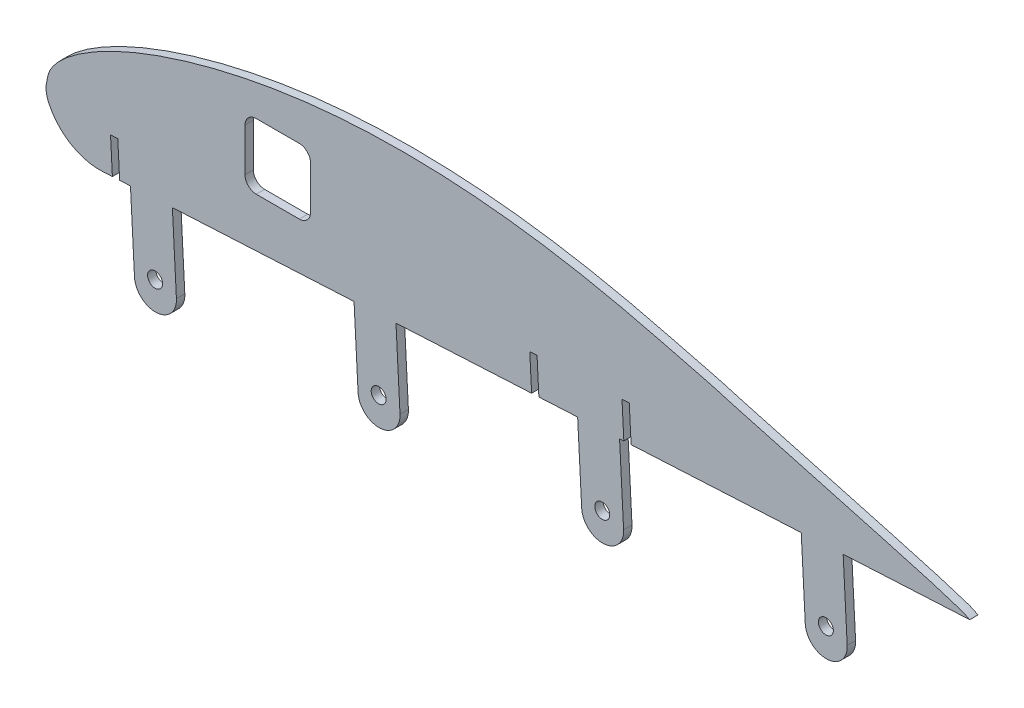
from build123d import *

# Parameters (mm, degrees)
BOSS_EXTRUDE1_DEPTH     = 1.905
BOSS_EXTRUDE2_START     = -1.905
BOSS_EXTRUDE2_DEPTH     = 3.81
TAP_DRILL_FOR_M8_TAP1_D = 6.8
FILLET1_R               = 5.08
CUT_EXTRUDE1_DEPTH      = 423.240896091
CUT_EXTRUDE1_DEPTH_BACK = 423.240896091
FILLET3_RADIUS          = 9.525
FILLET3_LENGTH          = 3.81
FILLET4_RADIUS          = 9.525
FILLET4_LENGTH          = 3.81
FILLET5_RADIUS          = 9.525
FILLET5_LENGTH          = 3.81
FILLET6_RADIUS          = 9.525
FILLET6_LENGTH          = 3.81


# Read off the part's stored shape, not the designer's step: Boss-Extrude2
with BuildPart() as part:
    # Sketch1 → Boss-Extrude1 (new, symmetric)
    with BuildSketch(Plane.XY):
        with BuildLine():
            Line((88.909580783, 41.26391721), (118.627580783, 41.26391721))
            Line((118.627580783, 41.26391721), (118.627580783, 11.54591721))
            Line((118.627580783, 11.54591721), (104.657580783, 11.54591721))
            Line((104.657580783, 11.54591721), (104.657580783, -6.092999308))
            add(Edge.make_bspline(
                [(104.657580783, -6.092999308), (105.78576696, -6.059407355), (110.631815253, -5.913506799), (119.301873398, -5.639779221), (130.760417354, -5.247131629), (142.497040297, -4.804534274), (154.470843852, -4.303823254), (166.639786874, -3.721010638), (178.960468691, -3.016797235), (191.389100737, -2.180004159), (203.882560612, -1.218144366), (216.39628583, -0.134616133), (228.885986304, 1.060875443), (241.307012185, 2.343253014), (253.616279039, 3.664244089), (265.772095128, 4.965053183), (277.731490713, 6.209836508), (289.45199663, 7.374456804), (300.891969345, 8.438297263), (312.011551274, 9.378204355), (322.771419978, 10.182138596), (333.133998236, 10.833574931), (343.062487119, 11.328143195), (352.522037602, 11.650436807), (361.47904928, 11.831540776), (369.902441551, 11.810346197), (377.762625202, 11.656292062), (385.030592513, 11.344437654), (391.68484956, 10.895614899), (397.689387538, 10.328444191), (403.063035719, 9.638969084), (407.663858949, 8.932969554), (411.84953295, 7.985992463), (414.53368223, 7.52009233), (419.143107129, 5.466978357), (414.520586066, 7.829160816), (411.856340794, 8.603478482), (407.655866836, 10.032984433), (403.060664813, 11.413668567), (397.685628885, 12.995705784), (391.682523818, 14.702815518), (385.029118067, 16.561547034), (377.76192652, 18.564224708), (369.902953821, 20.715322997), (361.480188002, 23.009061308), (352.523844819, 25.446080399), (343.06573052, 28.021990963), (333.136012333, 30.718866033), (322.7818834, 33.570585543), (311.975311356, 36.398897394), (300.975484828, 39.84355007), (289.42464591, 42.471486304), (277.760382476, 45.638812888), (265.799607232, 48.558228126), (253.647270041, 51.317410307), (241.333764909, 53.799191005), (228.908808416, 55.982875957), (216.414443808, 57.828987679), (203.896579889, 59.324649469), (191.398887145, 60.45608609), (178.965067687, 61.204134062), (166.639581281, 61.567998585), (154.466261788, 61.564684681), (142.487428182, 61.192168146), (130.745466135, 60.461851913), (119.27965342, 59.390109524), (108.135195394, 57.951193311), (97.349793586, 56.195302776), (86.959680907, 54.167962822), (77.001482933, 51.901273201), (67.510182352, 49.425050582), (58.519352194, 46.765961709), (50.060387838, 43.951821062), (42.162499305, 41.011003286), (34.853856572, 37.969908862), (28.15980047, 34.856885781), (22.102555486, 31.702210335), (16.703758276, 28.533121102), (11.978464499, 25.379509483), (7.942830392, 22.262794683), (4.5824322, 19.18797639), (1.957778069, 16.087560883), (-0.207226816, 12.684684668), (-0.907805064, 9.228884918), (-1.560514008, 5.882802979), (-1.147165708, 2.816033578), (-0.009188676, -0.274836968), (1.841756771, -3.001235322), (4.508620223, -5.171701763), (7.983340931, -6.442446365), (12.066016603, -7.059329176), (16.790523111, -7.394736703), (22.181697881, -7.563354981), (28.230842797, -7.674266105), (34.916798872, -7.484533075), (42.21994635, -7.600539498), (50.111658487, -7.421501694), (58.565799156, -7.276468805), (67.552092336, -7.074739405), (77.0391238, -6.84918955), (86.993460829, -6.592701098), (95.404954455, -6.362178203), (100.494330717, -6.215531943), (102.117580783, -6.167999853)],
                knots=[0.639208193, 0.639208193, 0.639208193, 0.639208193, 0.643094929, 0.655903573, 0.669079202, 0.6825766, 0.696348373, 0.710348009, 0.724529116, 0.738844327, 0.753243365, 0.767678182, 0.782097111, 0.79644888, 0.810678263, 0.824728613, 0.838547559, 0.852083943, 0.865287848, 0.878111787, 0.890511304, 0.902443005, 0.913865891, 0.924742046, 0.935035831, 0.944714495, 0.953747112, 0.962105881, 0.969765452, 0.97670305, 0.982898839, 0.988333206, 0.992993712, 0.996866343, 1, 1.003263265, 1.007250558, 1.012051787, 1.017662333, 1.024068314, 1.031249696, 1.03918465, 1.047847638, 1.057210696, 1.067242333, 1.07790876, 1.089173985, 1.100998599, 1.113341295, 1.126157183, 1.139462308, 1.15301104, 1.166927615, 1.181082, 1.19540448, 1.209838051, 1.224332605, 1.238841949, 1.253325073, 1.267739982, 1.282048685, 1.296212777, 1.310196043, 1.323962314, 1.337476235, 1.350702495, 1.363610632, 1.376163959, 1.388325705, 1.400058826, 1.41132739, 1.422098222, 1.43233946, 1.442020271, 1.451113163, 1.459592207, 1.467434959, 1.474622154, 1.48114013, 1.486983094, 1.492171114, 1.496782496, 1.500970226, 1.505871632, 1.508789423, 1.512670174, 1.516325668, 1.520069902, 1.523879651, 1.527960743, 1.532641784, 1.538069255, 1.544264221, 1.551214848, 1.558899645, 1.567291448, 1.576362099, 1.586079537, 1.596409112, 1.607314709, 1.618758332, 1.630699138, 1.636291347, 1.636291347, 1.636291347, 1.636291347], degree=3))
            Line((102.117580783, -6.167999853), (102.117580783, 11.54591721))
            Line((102.117580783, 11.54591721), (88.909580783, 11.54591721))
            Line((88.909580783, 11.54591721), (88.909580783, 41.26391721))
        make_face()
    extrude(amount=BOSS_EXTRUDE1_DEPTH, both=True)

    # Boss-Extrude2 outline → Boss-Extrude2 (add)
    with BuildSketch(Plane.XY.offset(BOSS_EXTRUDE2_START)):
        with BuildLine():
            Line((104.657580783, 11.54591721), (102.117580783, 11.54591721))
            Line((102.117580783, 11.54591721), (102.117580783, -6.167999853))
            add(Edge.make_bspline(
                [(0, 0), (0.032082235, -0.06523567), (0.553122873, -1.103108425), (1.841756771, -3.001235322), (4.508620223, -5.171701763), (7.983340931, -6.442446365), (12.066016603, -7.059329176), (16.790523111, -7.394736703), (22.181697881, -7.563354981), (28.230842797, -7.674266105), (34.916798872, -7.484533075), (42.21994635, -7.600539498), (50.111658487, -7.421501694), (58.565799156, -7.276468805), (67.552092336, -7.074739405), (77.0391238, -6.84918955), (86.993460829, -6.592701098), (95.404954455, -6.362178203), (100.494330717, -6.215531943), (102.117580783, -6.167999853)],
                knots=[1.516075579, 1.516075579, 1.516075579, 1.516075579, 1.516325668, 1.520069902, 1.523879651, 1.527960743, 1.532641784, 1.538069255, 1.544264221, 1.551214848, 1.558899645, 1.567291448, 1.576362099, 1.586079537, 1.596409112, 1.607314709, 1.618758332, 1.630699138, 1.636291347, 1.636291347, 1.636291347, 1.636291347], degree=3))
            ThreePointArc((0, 0), (9.93879362, -10.878398923), (24.244645014, -14.408526068))
            Line((24.244645014, -14.408526068), (36.927240105, -13.743859424))
            Line((36.927240105, -13.743859424), (39.25357336, -58.132942244))
            Line((39.25357336, -58.132942244), (58.277465998, -57.135942277))
            Line((58.277465998, -57.135942277), (55.951132743, -12.746859457))
            Line((55.951132743, -12.746859457), (138.388000837, -8.42652627))
            Line((138.388000837, -8.42652627), (140.714334092, -52.815609089))
            Line((140.714334092, -52.815609089), (159.738226729, -51.818609123))
            Line((159.738226729, -51.818609123), (157.411893474, -7.429526303))
            Line((157.411893474, -7.429526303), (239.848761568, -3.109193115))
            Line((239.848761568, -3.109193115), (242.175094823, -47.498275935))
            Line((242.175094823, -47.498275935), (261.19898746, -46.501275969))
            Line((261.19898746, -46.501275969), (258.872654205, -2.112193149))
            Line((258.872654205, -2.112193149), (341.309522299, 2.208140039))
            Line((341.309522299, 2.208140039), (343.635855554, -42.180942781))
            Line((343.635855554, -42.180942781), (362.659748191, -41.183942814))
            Line((362.659748191, -41.183942814), (360.333414936, 3.205140005))
            Line((360.333414936, 3.205140005), (417.54003932, 6.203212141))
            add(Edge.make_bspline(
                [(104.657580783, -6.092999308), (105.78576696, -6.059407355), (110.631815253, -5.913506799), (119.301873398, -5.639779221), (130.760417354, -5.247131629), (142.497040297, -4.804534274), (154.470843852, -4.303823254), (166.639786874, -3.721010638), (178.960468691, -3.016797235), (191.389100737, -2.180004159), (203.882560612, -1.218144366), (216.39628583, -0.134616133), (228.885986304, 1.060875443), (241.307012185, 2.343253014), (253.616279039, 3.664244089), (265.772095128, 4.965053183), (277.731490713, 6.209836508), (289.45199663, 7.374456804), (300.891969345, 8.438297263), (312.011551274, 9.378204355), (322.771419978, 10.182138596), (333.133998236, 10.833574931), (343.062487119, 11.328143195), (352.522037602, 11.650436807), (361.47904928, 11.831540776), (369.902441551, 11.810346197), (377.762625202, 11.656292062), (385.030592513, 11.344437654), (391.68484956, 10.895614899), (397.689387538, 10.328444191), (403.063035719, 9.638969084), (407.663858949, 8.932969554), (411.84953295, 7.985992463), (414.389124606, 7.545183862), (417.126697281, 6.361596446), (417.54003932, 6.203212141)],
                knots=[0.639208193, 0.639208193, 0.639208193, 0.639208193, 0.643094929, 0.655903573, 0.669079202, 0.6825766, 0.696348373, 0.710348009, 0.724529116, 0.738844327, 0.753243365, 0.767678182, 0.782097111, 0.79644888, 0.810678263, 0.824728613, 0.838547559, 0.852083943, 0.865287848, 0.878111787, 0.890511304, 0.902443005, 0.913865891, 0.924742046, 0.935035831, 0.944714495, 0.953747112, 0.962105881, 0.969765452, 0.97670305, 0.982898839, 0.988333206, 0.992993712, 0.996866343, 0.999371673, 0.999371673, 0.999371673, 0.999371673], degree=3))
            Line((104.657580783, -6.092999308), (104.657580783, 11.54591721))
        make_face()
    extrude(amount=BOSS_EXTRUDE2_DEPTH)

    # Tap Drill for M8 Tap1 (through all)
    with Locations(Plane.XY.offset(1.905)):
        with Locations((48.100853035, -44.951847169), (149.561613766, -39.634514015), (251.022374497, -34.31718086), (352.483135228, -28.999847706)):
            Hole(TAP_DRILL_FOR_M8_TAP1_D / 2)

    # Fillet1
    fillet1_edges = [part.edges().sort_by_distance(p)[0] for p in [
        (88.909580783, 11.54591721, 0),
        (118.627580783, 11.54591721, 0),
        (118.627580783, 41.26391721, 0),
        (88.909580783, 41.26391721, 0),
    ]]
    fillet(fillet1_edges, radius=FILLET1_R)

    # Sketch8 → Cut-Extrude1 (cut, two sides: drawn at the far end of the back side and taken through both)
    with BuildSketch(Plane.XY.offset(1.905).offset(-CUT_EXTRUDE1_DEPTH_BACK)):
        Polygon((32.01864182, -14.001108159), (31.181161848, 1.978961656), (27.883687124, 1.806148328), (28.721167096, -14.173921487), align=None)
        Polygon((222.257568191, -4.031108495), (221.420088219, 11.94896132), (218.122613495, 11.776147993), (218.960093467, -4.203921823), align=None)
        Polygon((264.110131992, -1.837708569), (263.27265202, 14.142361246), (259.975177297, 13.969547919), (260.812657268, -2.010521896), align=None)
    extrude(amount=CUT_EXTRUDE1_DEPTH + CUT_EXTRUDE1_DEPTH_BACK, mode=Mode.SUBTRACT)

    # Fillet3: full round fillet: the end face becomes a half cylinder, R = half its width
    fillet3_face = Plane((48.765519679, -57.634442261, 0), x_dir=(0, 0, -1), z_dir=(0.05233595627, -0.998629534753, 0))  # on the end face: x along it, z out of the body
    fillet3_slab = fillet3_face.offset(-FILLET3_RADIUS / 2) * Box(FILLET3_LENGTH, 2 * FILLET3_RADIUS, FILLET3_RADIUS, mode=Mode.PRIVATE)  # the body's end, R deep
    fillet3_round = Plane((48.267019696, -48.122495942, 0), x_dir=(0.05233595627, -0.998629534753, 0), z_dir=(0, 0, -1)) * Cylinder(FILLET3_RADIUS, FILLET3_LENGTH, mode=Mode.PRIVATE)  # its axis R under the face
    add(fillet3_slab - fillet3_round, mode=Mode.SUBTRACT)

    # Fillet4: full round fillet: the end face becomes a half cylinder, R = half its width
    fillet4_face = Plane((150.226280411, -52.317109106, 0), x_dir=(0, 0, 1), z_dir=(0.052335956221, -0.998629534756, 0))  # on the end face: x along it, z out of the body
    fillet4_slab = fillet4_face.offset(-FILLET4_RADIUS / 2) * Box(FILLET4_LENGTH, 2 * FILLET4_RADIUS, FILLET4_RADIUS, mode=Mode.PRIVATE)  # the body's end, R deep
    fillet4_round = Plane((149.727780428, -42.805162787, 0), x_dir=(0.052335956221, -0.998629534756, 0), z_dir=(0, 0, 1)) * Cylinder(FILLET4_RADIUS, FILLET4_LENGTH, mode=Mode.PRIVATE)  # its axis R under the face
    add(fillet4_slab - fillet4_round, mode=Mode.SUBTRACT)

    # Fillet5: full round fillet: the end face becomes a half cylinder, R = half its width
    fillet5_face = Plane((251.687041142, -46.999775952, 0), x_dir=(0, 0, 1), z_dir=(0.052335956221, -0.998629534756, 0))  # on the end face: x along it, z out of the body
    fillet5_slab = fillet5_face.offset(-FILLET5_RADIUS / 2) * Box(FILLET5_LENGTH, 2 * FILLET5_RADIUS, FILLET5_RADIUS, mode=Mode.PRIVATE)  # the body's end, R deep
    fillet5_round = Plane((251.188541159, -37.487829633, 0), x_dir=(0.052335956221, -0.998629534756, 0), z_dir=(0, 0, 1)) * Cylinder(FILLET5_RADIUS, FILLET5_LENGTH, mode=Mode.PRIVATE)  # its axis R under the face
    add(fillet5_slab - fillet5_round, mode=Mode.SUBTRACT)

    # Fillet6: full round fillet: the end face becomes a half cylinder, R = half its width
    fillet6_face = Plane((353.147801872, -41.682442798, 0), x_dir=(0, 0, -1), z_dir=(0.052335956273, -0.998629534753, 0))  # on the end face: x along it, z out of the body
    fillet6_slab = fillet6_face.offset(-FILLET6_RADIUS / 2) * Box(FILLET6_LENGTH, 2 * FILLET6_RADIUS, FILLET6_RADIUS, mode=Mode.PRIVATE)  # the body's end, R deep
    fillet6_round = Plane((352.649301888, -32.170496479, 0), x_dir=(0.052335956273, -0.998629534753, 0), z_dir=(0, 0, -1)) * Cylinder(FILLET6_RADIUS, FILLET6_LENGTH, mode=Mode.PRIVATE)  # its axis R under the face
    add(fillet6_slab - fillet6_round, mode=Mode.SUBTRACT)


solid = part.part
